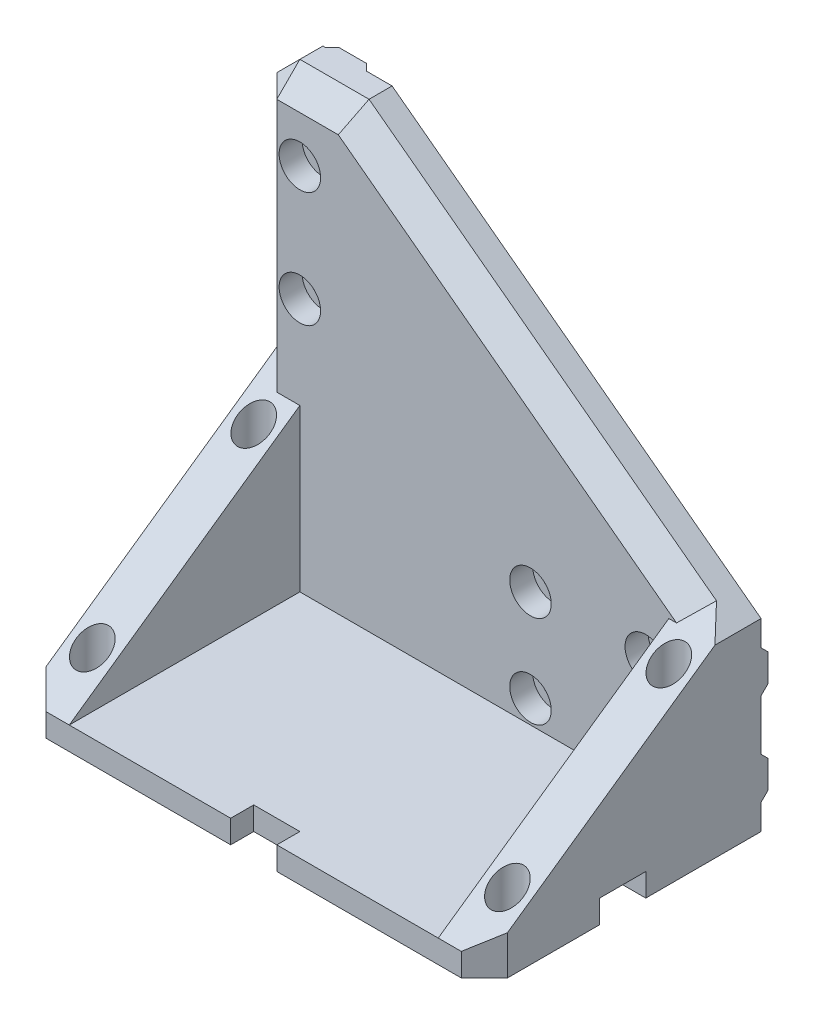
from build123d import *

# Parameters (mm, degrees)
BOSS_EXTRUDE1_DEPTH     = 10
SKETCH2_R               = 2.6
CUT_EXTRUDE1_DEPTH      = 142.774468788
SKETCH3_W               = 60
SKETCH3_H               = 9
SKETCH3_W_2             = 9
SKETCH3_H_2             = 60
BOSS_EXTRUDE3_DEPTH     = 1.46
CUT_EXTRUDE2_DEPTH      = 142.774468788
CUT_EXTRUDE2_DEPTH_BACK = 142.774468788
SKETCH2_2_R             = 2.6
CHAMFER1_SIZE           = 1.46
CUT_EXTRUDE3_START      = 10
SKETCH4_R               = 4.5
CUT_EXTRUDE3_DEPTH      = 5
SKETCH5_W               = 100
SKETCH5_H               = 50
BOSS_EXTRUDE4_DEPTH     = 5
BOSS_EXTRUDE5_DEPTH     = 10
BOSS_EXTRUDE6_START     = 100
BOSS_EXTRUDE6_DEPTH     = 10
CUT_EXTRUDE4_DEPTH      = 154.622914957
CUT_EXTRUDE4_DEPTH_BACK = 154.622914957
SKETCH10_R              = 1.75
CUT_EXTRUDE5_START      = 100
SKETCH11_R              = 3.5
CUT_EXTRUDE5_DEPTH      = 95
SKETCH12_W              = 10
SKETCH12_H              = 5
SKETCH12_W_2            = 5
SKETCH12_H_2            = 10
CUT_EXTRUDE6_DEPTH      = 5
CHAMFER2_SIZE           = 5


# Some blends are built 0.0001 mm under size
with BuildPart() as part:
    # Sketch1 → Boss-Extrude1 (new body)
    with BuildSketch(Plane.XY):
        Polygon((0, 0), (100, 0), (100, 40), (20, 100), (0, 100), align=None)
    extrude(amount=BOSS_EXTRUDE1_DEPTH)

    # Sketch2 → Cut-Extrude1 (cut, through all)
    with BuildSketch(Plane.XY):
        with Locations((10, 85)):
            Circle(SKETCH2_R)
        with Locations((10, 60)):
            Circle(SKETCH2_R)
        with Locations((85, 30)):
            Circle(SKETCH2_R)
        with Locations((85, 10)):
            Circle(SKETCH2_R)
        with Locations((60, 10)):
            Circle(SKETCH2_R)
        with Locations((60, 30)):
            Circle(SKETCH2_R)
    extrude(amount=CUT_EXTRUDE1_DEPTH, mode=Mode.SUBTRACT)

    # Sketch3 → Boss-Extrude3 (add)
    with BuildSketch(Plane.XY):
        with Locations((70, 30)):
            Rectangle(SKETCH3_W, SKETCH3_H)
        with Locations((70, 10)):
            Rectangle(SKETCH3_W, SKETCH3_H)
        with Locations((10, 70)):
            Rectangle(SKETCH3_W_2, SKETCH3_H_2)
    extrude(amount=-BOSS_EXTRUDE3_DEPTH)

    # Sketch2<2> → Cut-Extrude2 (cut, two sides: drawn at the far end of the back side and taken through both)
    with BuildSketch(Plane.XY.offset(-CUT_EXTRUDE2_DEPTH_BACK)):
        with Locations((10, 85)):
            Circle(SKETCH2_2_R)
        with Locations((10, 60)):
            Circle(SKETCH2_2_R)
        with Locations((85, 30)):
            Circle(SKETCH2_2_R)
        with Locations((85, 10)):
            Circle(SKETCH2_2_R)
        with Locations((60, 10)):
            Circle(SKETCH2_2_R)
        with Locations((60, 30)):
            Circle(SKETCH2_2_R)
    extrude(amount=CUT_EXTRUDE2_DEPTH + CUT_EXTRUDE2_DEPTH_BACK, mode=Mode.SUBTRACT)

    # Chamfer1
    chamfer1_edges = [part.edges().sort_by_distance(p)[0] for p in [
        (14.5, 70, -1.46),
        (5.5, 70, -1.46),
        (70, 5.5, -1.46),
        (70, 14.5, -1.46),
        (70, 25.5, -1.46),
        (70, 34.5, -1.46),
    ]]
    chamfer(chamfer1_edges, length=CHAMFER1_SIZE - 0.0001)  # a hair under: the kernel refuses the full size

    # Sketch4 → Cut-Extrude3 (cut)
    with BuildSketch(Plane.XY.offset(CUT_EXTRUDE3_START)):
        with Locations((10, 85)):
            Circle(SKETCH4_R)
        with Locations((10, 60)):
            Circle(SKETCH4_R)
        with Locations((60, 30)):
            Circle(SKETCH4_R)
        with Locations((85, 30)):
            Circle(SKETCH4_R)
        with Locations((85, 10)):
            Circle(SKETCH4_R)
        with Locations((60, 10)):
            Circle(SKETCH4_R)
    extrude(amount=-CUT_EXTRUDE3_DEPTH, mode=Mode.SUBTRACT)

    # Sketch5 → Boss-Extrude4 (add)
    with BuildSketch(Plane(origin=(0, 0, 0), x_dir=(1, 0, 0), z_dir=(0, 1, 0))):
        with Locations((50, -35)):
            Rectangle(SKETCH5_W, SKETCH5_H)
    extrude(amount=BOSS_EXTRUDE4_DEPTH)

    # Sketch8 → Boss-Extrude5 (add)
    with BuildSketch(Plane(origin=(0, 0, 0), x_dir=(0, 0, -1), z_dir=(1, 0, 0))):
        Polygon((-10, 5), (-60, 5), (-10, 40), align=None)
    extrude(amount=BOSS_EXTRUDE5_DEPTH)

    # Sketch8<2> → Boss-Extrude6 (add)
    with BuildSketch(Plane(origin=(0, 0, 0), x_dir=(0, 0, -1), z_dir=(1, 0, 0)).offset(BOSS_EXTRUDE6_START)):
        Polygon((-10, 5), (-60, 5), (-10, 40), align=None)
    extrude(amount=-BOSS_EXTRUDE6_DEPTH)

    # Sketch10 → Cut-Extrude4 (cut, two sides: drawn at the far end of the back side and taken through both)
    with BuildSketch(Plane(origin=(0, 0, 0), x_dir=(1, 0, 0), z_dir=(0, 1, 0)).offset(-CUT_EXTRUDE4_DEPTH_BACK)):
        with Locations(Location((5, -50, 0), (0, 0, 270))):
            Circle(SKETCH10_R)
        with Locations(Location((95, -50, 0), (0, 0, 270))):
            Circle(SKETCH10_R)
        with Locations(Location((95, -15, 0), (0, 0, 270))):
            Circle(SKETCH10_R)
        with Locations(Location((5, -15, 0), (0, 0, 270))):
            Circle(SKETCH10_R)
    extrude(amount=CUT_EXTRUDE4_DEPTH + CUT_EXTRUDE4_DEPTH_BACK, mode=Mode.SUBTRACT)

    # Sketch11 → Cut-Extrude5 (cut)
    with BuildSketch(Plane(origin=(0, 0, 0), x_dir=(1, 0, 0), z_dir=(0, 1, 0)).offset(CUT_EXTRUDE5_START)):
        with Locations(Location((5, -15, 0), (0, 0, 270))):
            Circle(SKETCH11_R)
        with Locations(Location((5, -50, 0), (0, 0, 270))):
            Circle(SKETCH11_R)
        with Locations(Location((95, -50, 0), (0, 0, 270))):
            Circle(SKETCH11_R)
        with Locations(Location((95, -15, 0), (0, 0, 270))):
            Circle(SKETCH11_R)
    extrude(amount=-CUT_EXTRUDE5_DEPTH, mode=Mode.SUBTRACT)

    # Sketch12 → Cut-Extrude6 (cut)
    with BuildSketch(Plane(origin=(0, 0, 0), x_dir=(1, 0, 0), z_dir=(0, 1, 0))):
        with Locations((50, -57.5)):
            Rectangle(SKETCH12_W, SKETCH12_H)
        with Locations((97.5, -30)):
            Rectangle(SKETCH12_W_2, SKETCH12_H_2)
        with Locations((2.5, -30)):
            Rectangle(SKETCH12_W_2, SKETCH12_H_2)
    extrude(amount=CUT_EXTRUDE6_DEPTH, mode=Mode.SUBTRACT)

    # Chamfer2
    # the kernel refuses this chamfer: 5 mm, written as the material it takes off along each edge
    with BuildSketch(Plane(origin=(3.333333333, 96.666666667, 6.666666667), x_dir=(-0.7071067811865474, 0, -0.7071067811865476), z_dir=(-0.5773502691896258, 0.5773502691896257, 0.5773502691896257))) as chamfer2_piece_1:
        Polygon((-3.535533906, 2.041241452), (3.535533906, 2.041241452), (0, -4.082482905), align=None)
    extrude(amount=6.350852961, mode=Mode.SUBTRACT)
    with BuildSketch(Plane(origin=(110.286731952, 32.284951036, 10), x_dir=(0.016497525966350957, 0.021996701288467948, -0.9996219169112968), z_dir=(-0.8000000000000002, 0.6, 0))) as chamfer2_piece_2_section:
        Polygon((CHAMFER2_SIZE * 0.999621916911, CHAMFER2_SIZE * 0.0274958766106), (-CHAMFER2_SIZE * 0.0274958766106, CHAMFER2_SIZE * 0.999621916911), (0, 0), align=None)
    chamfer2_piece_2 = extrude(amount=125.71682988, mode=Mode.PRIVATE)
    chamfer2_piece_2 = split(chamfer2_piece_2, bisect_by=Plane(origin=(56.438385269, 50.830938552, -5.472769359), z_dir=(0, 0.8192319205190406, 0.5734623443633283)), keep=Keep.TOP, mode=Mode.PRIVATE)
    add(chamfer2_piece_2, mode=Mode.SUBTRACT)
    with BuildSketch(Plane(origin=(100, -12.85841494, 60), x_dir=(0.0274958766105877, 0, -0.9996219169112968), z_dir=(0, 1, 0))) as chamfer2_piece_3:
        Polygon((CHAMFER2_SIZE * 0.999621916911, CHAMFER2_SIZE * 0.0274958766106), (-CHAMFER2_SIZE * 0.0274958766106, CHAMFER2_SIZE * 0.999621916911), (0, 0), align=None)
    extrude(amount=30.71682988, mode=Mode.SUBTRACT)
    with BuildSketch(Plane(origin=(0, -12.85841494, 60), x_dir=(-0.027495876610586372, 0, -0.9996219169112968), z_dir=(0, 1, 0))) as chamfer2_piece_4:
        Polygon((CHAMFER2_SIZE * 0.999621916911, -CHAMFER2_SIZE * 0.0274958766106), (-CHAMFER2_SIZE * 0.0274958766106, -CHAMFER2_SIZE * 0.999621916911), (0, 0), align=None)
    extrude(amount=30.71682988, mode=Mode.SUBTRACT)
    with BuildSketch(Plane(origin=(32.85841494, 100, 10), x_dir=(0, 0.0274958766105877, -0.9996219169112968), z_dir=(-1, 0, 0))) as chamfer2_piece_5:
        Polygon((CHAMFER2_SIZE * 0.999621916911, CHAMFER2_SIZE * 0.0274958766106), (-CHAMFER2_SIZE * 0.0274958766106, CHAMFER2_SIZE * 0.999621916911), (0, 0), align=None)
    extrude(amount=45.71682988, mode=Mode.SUBTRACT)
    with BuildSketch(Plane(origin=(0, 112.85841494, 10), x_dir=(-0.02749587661058638, 0, -0.9996219169112968), z_dir=(0, -1, 0))) as chamfer2_piece_6_section:
        Polygon((CHAMFER2_SIZE * 0.999621916911, CHAMFER2_SIZE * 0.0274958766106), (-CHAMFER2_SIZE * 0.0274958766106, CHAMFER2_SIZE * 0.999621916911), (0, 0), align=None)
    chamfer2_piece_6 = extrude(amount=85.71682988, mode=Mode.PRIVATE)
    chamfer2_piece_6 = split(chamfer2_piece_6, bisect_by=Plane(origin=(1.674929178, 50.830938552, -5.472769359), z_dir=(0, 0.8192319205190406, 0.5734623443633283)), keep=Keep.TOP, mode=Mode.PRIVATE)
    add(chamfer2_piece_6, mode=Mode.SUBTRACT)
    with BuildSketch(Plane(origin=(0, 100, -12.85841494), x_dir=(-0.027495876610586313, -0.9996219169112968, 0), z_dir=(0, 0, 1))) as chamfer2_piece_7:
        Polygon((CHAMFER2_SIZE * 0.999621916911, CHAMFER2_SIZE * 0.0274958766106), (-CHAMFER2_SIZE * 0.0274958766106, CHAMFER2_SIZE * 0.999621916911), (0, 0), align=None)
    extrude(amount=35.71682988, mode=Mode.SUBTRACT)


solid = part.part
